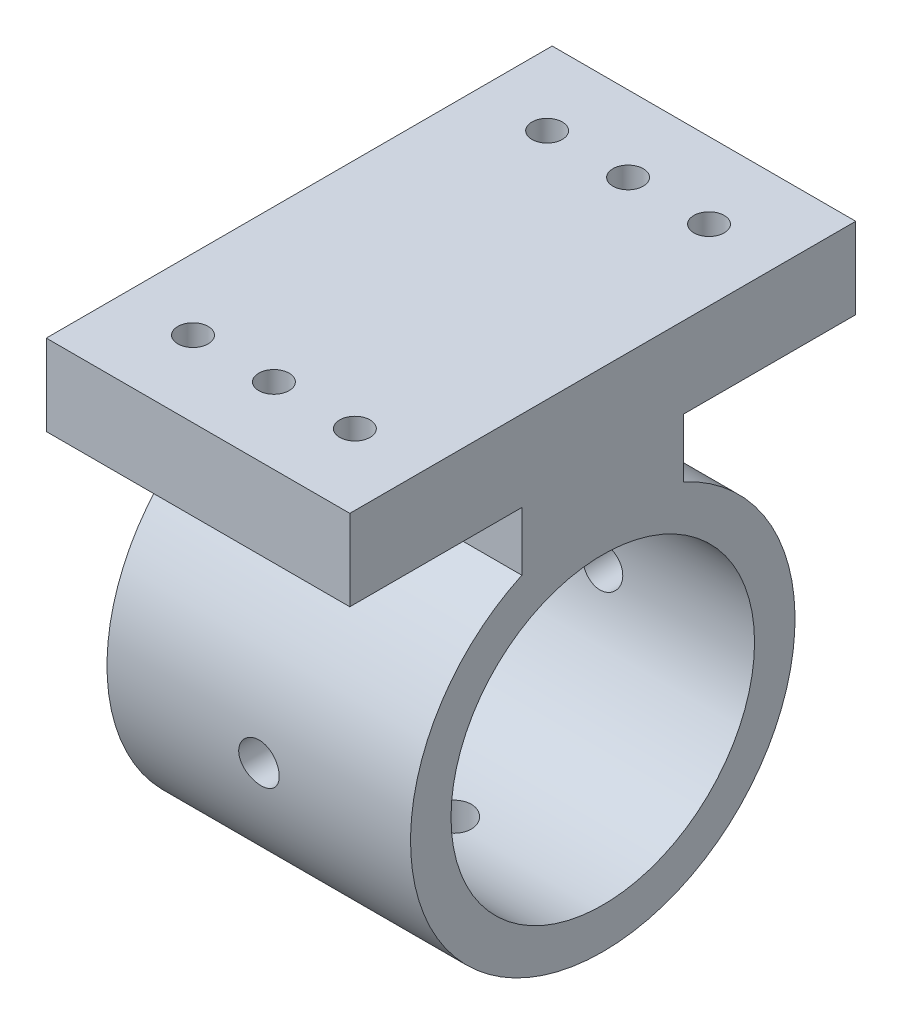
from build123d import *

# Parameters (mm, degrees)
EXTRUDE_START            = -30
EXTRUDE_1_OUTLINE_R      = 15
EXTRUDE_1_DEPTH          = 30
SKETCH_2_W               = 50.000000035
SKETCH_2_H               = 6
EXTRUDE_2_DEPTH          = 30
SKETCH_3_R               = 1.5
CUT_EXTRUDE_1_DEPTH      = 10
SKETCH_4_R               = 3.1
CUT_EXTRUDE_2_DEPTH      = 3
SKETCH_5_R               = 2
CUT_EXTRUDE_3_DEPTH      = 33
CUT_EXTRUDE_4_DEPTH      = 211.848116868
CUT_EXTRUDE_4_DEPTH_BACK = 211.848116868
SKETCH_6_R               = 2


# Read off the part's stored shape, not the designer's step: 填料-伸長1
with BuildPart() as part:
    # 填料-伸長1 outline → 填料-伸長1 (new body)
    with BuildSketch(Plane(origin=(26.04788271, 0, 0), x_dir=(0, 0, -1), z_dir=(1, 0, 0)).offset(EXTRUDE_START)):
        with BuildLine():
            Line((-188, 0.156954032), (-188, -5.64036342))
            ThreePointArc((-188, -5.64036342), (-180, -41.87405136), (-172, -5.64036342))
            Line((-172, -5.64036342), (-172, 0.156954032))
            Line((-172, 0.156954032), (-155, 0.156954032))
            Line((-155, 0.156954032), (-155, 2.156954032))
            Line((-155, 2.156954032), (-205, 2.156954032))
            Line((-205, 2.156954032), (-205, 0.156954032))
            Line((-205, 0.156954032), (-188, 0.156954032))
        make_face()
        with Locations((-180, -22.87405136)):
            Circle(EXTRUDE_1_OUTLINE_R, mode=Mode.SUBTRACT)
    extrude(amount=EXTRUDE_1_DEPTH)

    # 草圖2 → 填料-伸長2 (add)
    with BuildSketch(Plane(origin=(26.04788271, 0, 0), x_dir=(0, 0, -1), z_dir=(1, 0, 0))):
        with Locations((-179.999999983, 5.156954032)):
            Rectangle(SKETCH_2_W, SKETCH_2_H)
    extrude(amount=-EXTRUDE_2_DEPTH)

    # 草圖3 → 除料-伸長1 (cut)
    with BuildSketch(Plane.XZ.offset(-0.156954032)):
        with Locations(Location((19.04788271, 197.5, 0), (0, 0, 270))):
            Circle(SKETCH_3_R)
        with Locations(Location((19.04788271, 162.5, 0), (0, 0, 90))):
            Circle(SKETCH_3_R)
        with Locations(Location((3.04788271, 197.5, 0), (0, 0, 270))):
            Circle(SKETCH_3_R)
        with Locations(Location((3.04788271, 162.5, 0), (0, 0, 90))):
            Circle(SKETCH_3_R)
        with Locations(Location((11.04788271, 197.5, 0), (0, 0, 270))):
            Circle(SKETCH_3_R)
        with Locations(Location((11.04788271, 162.5, 0), (0, 0, 90))):
            Circle(SKETCH_3_R)
    extrude(amount=-CUT_EXTRUDE_1_DEPTH, mode=Mode.SUBTRACT)

    # 草圖4 → 除料-伸長2 (cut)
    with BuildSketch(Plane.XZ.offset(-0.156954032)):
        with Locations(Location((19.04788271, 162.5, 0), (0, 0, 270))):
            Circle(SKETCH_4_R)
        with Locations(Location((3.04788271, 162.5, 0), (0, 0, 270))):
            Circle(SKETCH_4_R)
        with Locations(Location((3.04788271, 197.5, 0), (0, 0, 90))):
            Circle(SKETCH_4_R)
        with Locations(Location((19.04788271, 197.5, 0), (0, 0, 90))):
            Circle(SKETCH_4_R)
        with Locations(Location((11.04788271, 197.5, 0), (0, 0, 270))):
            Circle(SKETCH_4_R)
        with Locations(Location((11.04788271, 162.5, 0), (0, 0, 90))):
            Circle(SKETCH_4_R)
    extrude(amount=-CUT_EXTRUDE_2_DEPTH, mode=Mode.SUBTRACT)

    # 草圖5 → 除料-伸長3 (cut)
    with BuildSketch(Plane(origin=(0, -50, 0), x_dir=(1, 0, 0), z_dir=(0, 1, 0))):
        with Locations(Location((11.04788271, -180, 0), (0, 0, 90))):
            Circle(SKETCH_5_R)
    extrude(amount=CUT_EXTRUDE_3_DEPTH, mode=Mode.SUBTRACT)

    # 草圖6 → 除料-伸長4 (cut, two sides: drawn at the far end of the back side and taken through both)
    with BuildSketch(Plane.XY.offset(-CUT_EXTRUDE_4_DEPTH_BACK)):
        with Locations(Location((11.04788271, -23.75720739, 0), (0, 0, 180))):
            Circle(SKETCH_6_R)
    extrude(amount=CUT_EXTRUDE_4_DEPTH + CUT_EXTRUDE_4_DEPTH_BACK, mode=Mode.SUBTRACT)


solid = part.part
